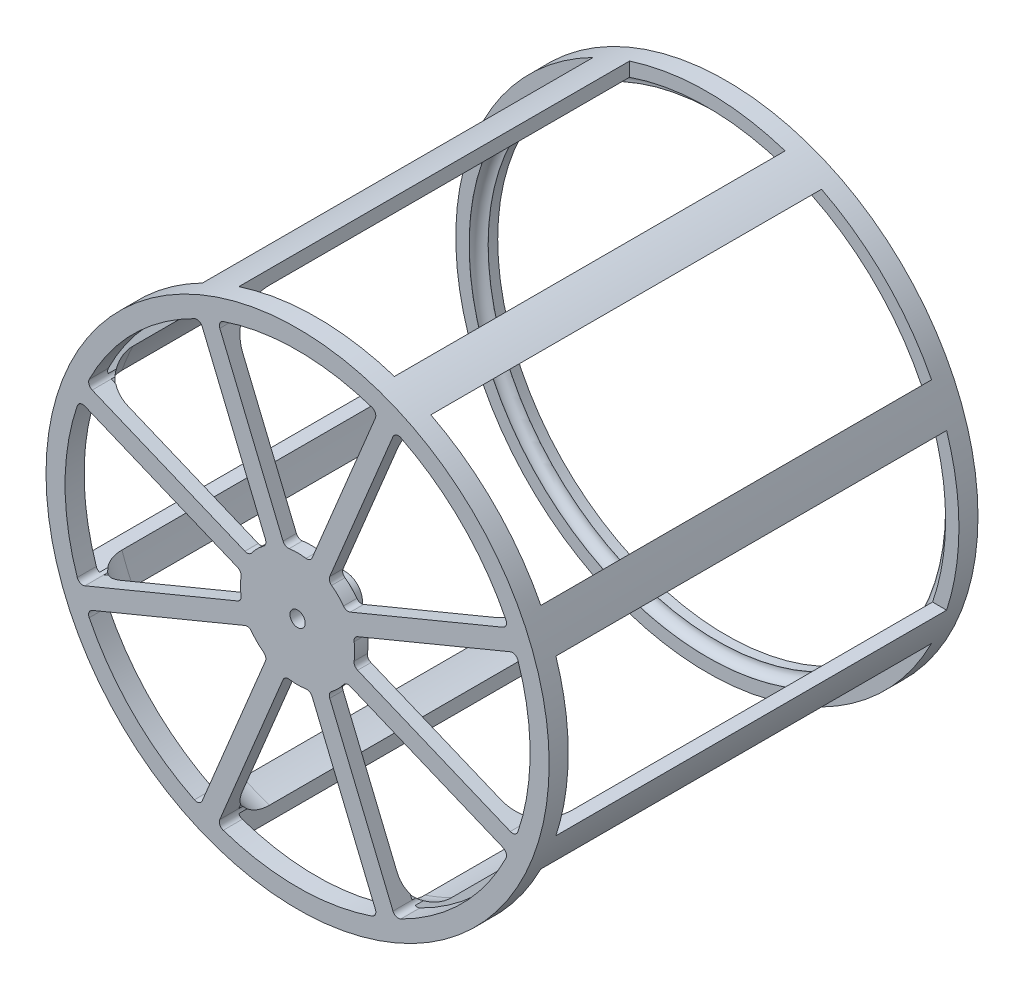
from build123d import *

# Parameters (mm, degrees)
SPOKE_DEPTH       = 7.62
TREAD_START       = 15.24
SKETCH4_W         = 20.734989156
SKETCH4_H         = 52.07
TREAD_DEPTH       = 60.018845049
CIRPATTERN1_COUNT = 8


with BuildPart() as part:
    # Sketch1 → Revolve1 (revolve)
    with BuildSketch(Plane(origin=(0, 0, 0), x_dir=(0, 0, -1), z_dir=(1, 0, 0))):
        with BuildLine():
            Line((1.778, 6.096), (1.778, 26.924))
            ThreePointArc((1.778, 26.924), (3.191502674, 30.336497326), (6.604, 31.75))
            Line((6.604, 31.75), (54.6354, 31.75))
            ThreePointArc((54.6354, 31.75), (55.5154651, 31.3854651), (55.88, 30.5054))
            Line((55.88, 30.5054), (55.88, 30.48))
            Line((55.88, 30.48), (57.15, 30.48))
            Line((57.15, 30.48), (57.15, 33.528))
            Line((57.15, 33.528), (0, 33.528))
            Line((0, 33.528), (0, 1.016))
            Line((0, 1.016), (6.35, 1.016))
            Line((6.35, 1.016), (6.35, 2.286))
            Line((6.35, 2.286), (5.588, 2.286))
            ThreePointArc((5.588, 2.286), (2.893923164, 3.401923164), (1.778, 6.096))
        make_face()
    revolve(axis=Axis((0, 0, 0), (0, 0, -1)))

    # Sketch3 → Spoke (cut)
    with BuildSketch(Plane.XY):
        with BuildLine():
            Line((1.938642336, 7.998966552), (10.367494578, 28.348015948))
            ThreePointArc((10.367494578, 28.348015948), (10.357288915, 28.954737662), (9.90711598, 29.361627968))
            ThreePointArc((9.90711598, 29.361627968), (0, 30.988), (-9.90711598, 29.361627968))
            ThreePointArc((-9.90711598, 29.361627968), (-10.357288915, 28.954737662), (-10.367494578, 28.348015948))
            Line((-10.367494578, 28.348015948), (-1.938642336, 7.998966552))
            ThreePointArc((-1.938642336, 7.998966552), (-1.610044564, 7.627457447), (-1.122405575, 7.536883025))
            ThreePointArc((-1.122405575, 7.536883025), (0, 7.62), (1.122405575, 7.536883025))
            ThreePointArc((1.122405575, 7.536883025), (1.610044564, 7.627457447), (1.938642336, 7.998966552))
        make_face()
    spoke = extrude(amount=-SPOKE_DEPTH, mode=Mode.SUBTRACT)

    # Sketch4 → Tread (cut, through all)
    with BuildSketch(Plane(origin=(0, 0, 0), x_dir=(1, 0, 0), z_dir=(0, 1, 0)).offset(TREAD_START)):
        with Locations((0, 28.575)):
            Rectangle(SKETCH4_W, SKETCH4_H)
    tread = extrude(amount=TREAD_DEPTH, mode=Mode.SUBTRACT)

    # CirPattern1: Spoke, Tread ×8 about axis
    cirpattern1_axis = Axis((0, 0, 0), (0, 0, 1))
    add([spoke.rotate(cirpattern1_axis, i * 360 / CIRPATTERN1_COUNT) for i in range(1, CIRPATTERN1_COUNT)], mode=Mode.SUBTRACT)
    add([tread.rotate(cirpattern1_axis, i * 360 / CIRPATTERN1_COUNT) for i in range(1, CIRPATTERN1_COUNT)], mode=Mode.SUBTRACT)


solid = part.part
